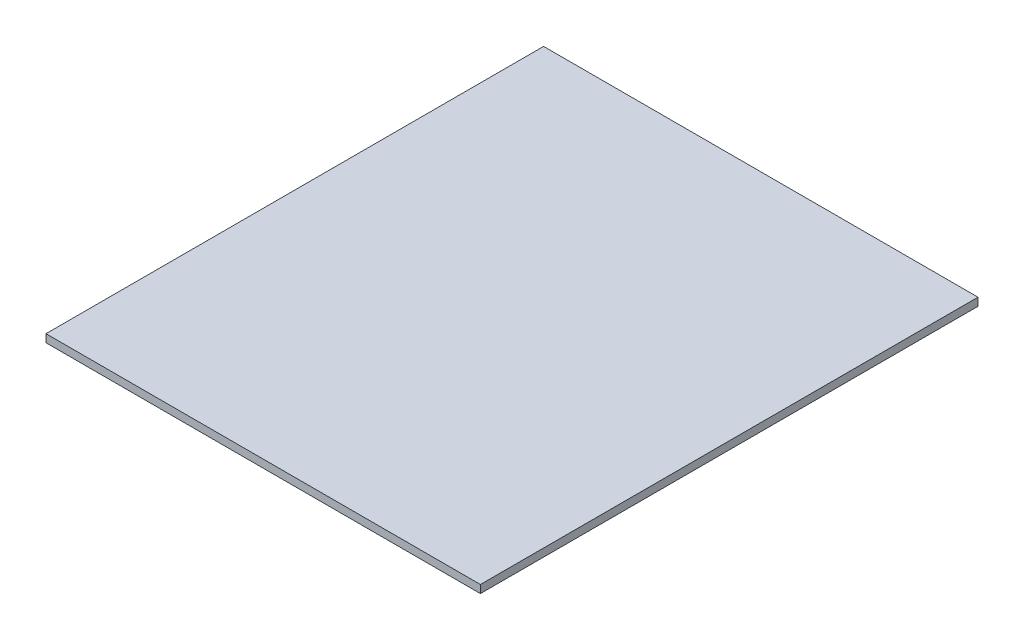
from build123d import *

# Parameters (mm, degrees)
SKETCH1_W           = 550
SKETCH1_H           = 630
BOSS_EXTRUDE1_DEPTH = 10


with BuildPart() as part:
    # Sketch1 → Boss-Extrude1 (new body)
    with BuildSketch(Plane(origin=(0, 0, 0), x_dir=(1, 0, 0), z_dir=(0, 1, 0))):
        Rectangle(SKETCH1_W, SKETCH1_H)
    extrude(amount=BOSS_EXTRUDE1_DEPTH)


solid = part.part
